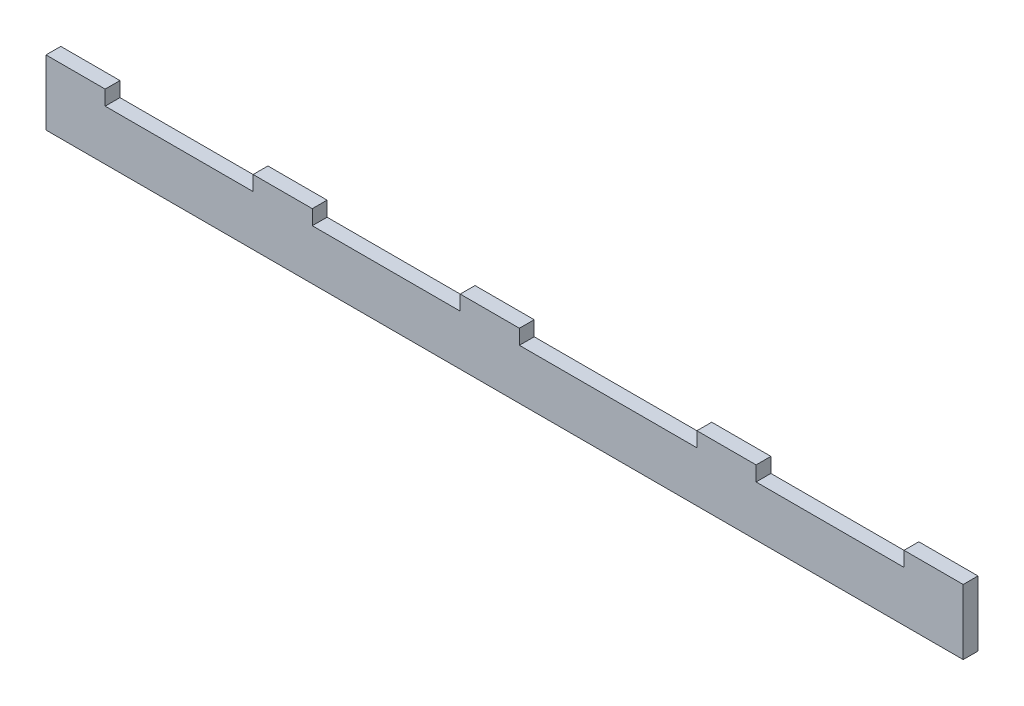
from build123d import *

# Parameters (mm, degrees)
BOSS_EXTRU_2_DEPTH = 5


with BuildPart() as part:
    # Esquisse1 → Boss.-Extru.2 (new body)
    with BuildSketch(Plane.XY):
        Polygon((0, 0), (310, 0), (310, 22), (290, 22), (290, 17), (240, 17), (240, 22), (220, 22), (220, 17), (160, 17), (160, 22), (140, 22), (140, 17), (90, 17), (90, 22), (70, 22), (70, 17), (20, 17), (20, 22), (0, 22), align=None)
    extrude(amount=BOSS_EXTRU_2_DEPTH)


solid = part.part
